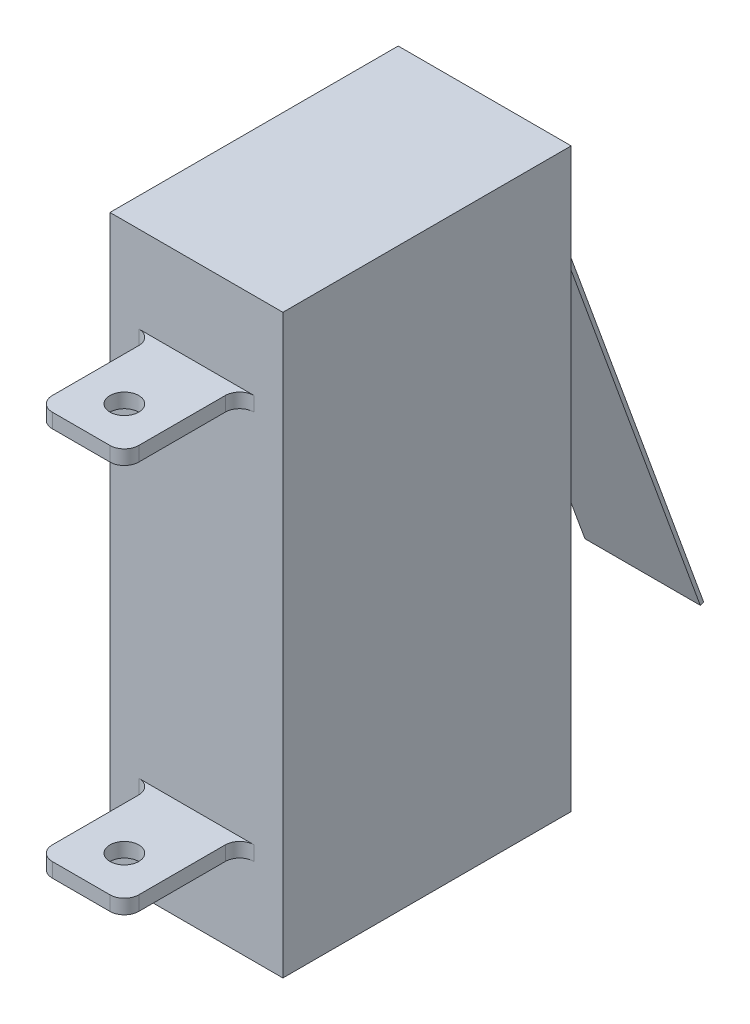
from build123d import *

# Parameters (mm, degrees)
SKETCH1_W               = 10
SKETCH1_H               = 20
BOSS_EXTRUDE1_DEPTH     = 6
SKETCH2_W               = 3
SKETCH2_H               = 0.5
BOSS_EXTRUDE2_DEPTH     = 4
FILLET1_R               = 0.5
CUT_EXTRUDE1_DEPTH      = 21.14944168
CUT_EXTRUDE1_DEPTH_BACK = 21.14944168
SKETCH3_R               = 0.5
BOSS_EXTRUDE3_DEPTH     = 2
FILLET2_R               = 0.5
FILLET3_R               = 0.125


with BuildPart() as part:
    # Sketch1 → Boss-Extrude1 (new body)
    with BuildSketch(Plane(origin=(0, 0, 0), x_dir=(0, 0, -1), z_dir=(1, 0, 0))):
        Rectangle(SKETCH1_W, SKETCH1_H)
    extrude(amount=BOSS_EXTRUDE1_DEPTH)

    # Sketch2 → Boss-Extrude2 (add)
    with BuildSketch(Plane.XY.offset(5)):
        with Locations((3, 6.75)):
            Rectangle(SKETCH2_W, SKETCH2_H)
        with Locations((3, -6.75)):
            Rectangle(SKETCH2_W, SKETCH2_H)
    extrude(amount=BOSS_EXTRUDE2_DEPTH)

    # Fillet1
    fillet1_edges = [part.edges().sort_by_distance(p)[0] for p in [
        (1.5, 6.75, 5),
        (4.5, 6.75, 5),
        (1.5, 6.75, 9),
        (4.5, 6.75, 9),
        (1.5, -6.75, 5),
        (4.5, -6.75, 5),
        (1.5, -6.75, 9),
        (4.5, -6.75, 9),
    ]]
    fillet(fillet1_edges, radius=FILLET1_R)

    # Sketch3 → Cut-Extrude1 (cut, two sides: drawn at the far end of the back side and taken through both)
    with BuildSketch(Plane(origin=(0, 7, 0), x_dir=(1, 0, 0), z_dir=(0, 1, 0)).offset(-CUT_EXTRUDE1_DEPTH_BACK)):
        with Locations(Location((3, -7.5, 0), (0, 0, 270))):
            Circle(SKETCH3_R)
    extrude(amount=CUT_EXTRUDE1_DEPTH + CUT_EXTRUDE1_DEPTH_BACK, mode=Mode.SUBTRACT)

    # Sketch4 → Boss-Extrude3 (add, symmetric)
    with BuildSketch(Plane(origin=(3, 0, 0), x_dir=(0, 0, -1), z_dir=(1, 0, 0))):
        Polygon((5, 7), (5.5, 7), (10.59558328, -7), (10.478121702, -7.042752518), (5.412474058, 6.875), (5, 6.875), (4.5, 6.875), (4.5, 7), align=None)
    extrude(amount=BOSS_EXTRUDE3_DEPTH, both=True)

    # Fillet2
    fillet2_edges = [part.edges().sort_by_distance(p)[0] for p in [
        (3, 7, -5.5),
        (3, 6.875, -5.412474058),
    ]]
    fillet(fillet2_edges, radius=FILLET2_R)

    # Fillet3
    # the kernel refuses this fillet: 0.125 mm, written as the material it adds along each edge
    with BuildSketch(Plane(origin=(1, 6.875, -5), x_dir=(-1, 0, 0), z_dir=(0, 1, 0)), Plane(origin=(5, 6.875, -5), x_dir=(0, 0, -1), z_dir=(0, 1, 0))) as fillet3_piece_1:
        with BuildLine():
            CenterArc((FILLET3_R, -FILLET3_R), FILLET3_R, 90, 90)
            Line((0, -FILLET3_R), (-FILLET3_R * 0.02, -FILLET3_R))
            Line((-FILLET3_R * 0.02, -FILLET3_R), (-FILLET3_R * 0.02, FILLET3_R * 0.02))
            Line((-FILLET3_R * 0.02, FILLET3_R * 0.02), (FILLET3_R, FILLET3_R * 0.02))
            Line((FILLET3_R, FILLET3_R * 0.02), (FILLET3_R, 0))
        make_face()
    extrude(amount=0.125)
    with BuildSketch(Plane(origin=(1, 6.875, -5), x_dir=(0, -1, 0), z_dir=(1, 0, 0))) as fillet3_piece_2:
        with BuildLine():
            CenterArc((0.130266962, 0.125), FILLET3_R, 170.385831611, 99.614168389)
            Line((0.007022616, 0.14587657), (-0.005301818, 0.147964228))
            ThreePointArc((-0.005301818, 0.147964228), (-0.0125, 0.062370289), (-0.0125, 0))
            Line((-0.0125, 0), (0, -0.0125))
            Line((0, -0.0125), (0.130266962, -0.0125))
            Line((0.130266962, -0.0125), (0.130266962, 0))
        make_face()
    extrude(amount=4)
    with BuildSketch(Plane(origin=(5, 7, -5), x_dir=(0, 0, -1), z_dir=(-1, 0, 0))) as fillet3_piece_3:
        with BuildLine():
            CenterArc((FILLET3_R, -FILLET3_R), FILLET3_R, 90, 90)
            Line((0, -FILLET3_R), (-FILLET3_R * 0.02, -FILLET3_R))
            Line((-FILLET3_R * 0.02, -FILLET3_R), (-FILLET3_R * 0.02, FILLET3_R * 0.02))
            Line((-FILLET3_R * 0.02, FILLET3_R * 0.02), (FILLET3_R, FILLET3_R * 0.02))
            Line((FILLET3_R, FILLET3_R * 0.02), (FILLET3_R, 0))
        make_face()
    extrude(amount=4)
    with BuildSketch(Plane(origin=(0.634886225, 6.875, -5), x_dir=(0, -1, 0), z_dir=(1, 0, 0))) as fillet3_piece_4a_section:
        with BuildLine():
            CenterArc((0.130266962, 0.125), FILLET3_R, 170.385831611, 99.614168389)
            Line((0.007022616, 0.14587657), (-0.005301818, 0.147964228))
            ThreePointArc((-0.005301818, 0.147964228), (-0.0125, 0.062370289), (-0.0125, 0))
            Line((-0.0125, 0), (0, -0.0125))
            Line((0, -0.0125), (0.130266962, -0.0125))
            Line((0.130266962, -0.0125), (0.130266962, 0))
        make_face()
    fillet3_piece_4a = extrude(amount=4.365113775, mode=Mode.PRIVATE)
    fillet3_piece_4a = split(fillet3_piece_4a, bisect_by=Plane(origin=(1, 6.846895643, -5.033240906), z_dir=(-1, 0, 0)), keep=Keep.TOP, mode=Mode.PRIVATE)
    with BuildSketch(Plane(origin=(1, 6.5625, -5), x_dir=(-1, 0, 0), z_dir=(0, 1, 0))) as fillet3_piece_4b_section:
        with BuildLine():
            CenterArc((FILLET3_R, -FILLET3_R), FILLET3_R, 90, 90)
            Line((0, -FILLET3_R), (-FILLET3_R * 0.02, -FILLET3_R))
            Line((-FILLET3_R * 0.02, -FILLET3_R), (-FILLET3_R * 0.02, FILLET3_R * 0.02))
            Line((-FILLET3_R * 0.02, FILLET3_R * 0.02), (FILLET3_R, FILLET3_R * 0.02))
            Line((FILLET3_R, FILLET3_R * 0.02), (FILLET3_R, 0))
        make_face()
    fillet3_piece_4b = extrude(amount=0.4375, mode=Mode.PRIVATE)
    fillet3_piece_4b = split(fillet3_piece_4b, bisect_by=Plane(origin=(0.971700611, 6.875, -5.028299389), z_dir=(0, -1, 0)), keep=Keep.TOP, mode=Mode.PRIVATE)
    fillet3_piece_4 = fillet3_piece_4a & fillet3_piece_4b
    add(fillet3_piece_4)
    with BuildSketch(Plane(origin=(5, 7, -5), x_dir=(0, 0, -1), z_dir=(-1, 0, 0))) as fillet3_piece_5a_section:
        with BuildLine():
            CenterArc((FILLET3_R, -FILLET3_R), FILLET3_R, 90, 90)
            Line((0, -FILLET3_R), (-FILLET3_R * 0.02, -FILLET3_R))
            Line((-FILLET3_R * 0.02, -FILLET3_R), (-FILLET3_R * 0.02, FILLET3_R * 0.02))
            Line((-FILLET3_R * 0.02, FILLET3_R * 0.02), (FILLET3_R, FILLET3_R * 0.02))
            Line((FILLET3_R, FILLET3_R * 0.02), (FILLET3_R, 0))
        make_face()
    fillet3_piece_5a = extrude(amount=4.3125, mode=Mode.PRIVATE)
    fillet3_piece_5a = split(fillet3_piece_5a, bisect_by=Plane(origin=(1, 7.028299389, -5.028299389), z_dir=(-1, 0, 0)), keep=Keep.TOP, mode=Mode.PRIVATE)
    with BuildSketch(Plane(origin=(1, 6.875, -5), x_dir=(-1, 0, 0), z_dir=(0, 1, 0))) as fillet3_piece_5b_section:
        with BuildLine():
            CenterArc((FILLET3_R, -FILLET3_R), FILLET3_R, 90, 90)
            Line((0, -FILLET3_R), (-FILLET3_R * 0.02, -FILLET3_R))
            Line((-FILLET3_R * 0.02, -FILLET3_R), (-FILLET3_R * 0.02, FILLET3_R * 0.02))
            Line((-FILLET3_R * 0.02, FILLET3_R * 0.02), (FILLET3_R, FILLET3_R * 0.02))
            Line((FILLET3_R, FILLET3_R * 0.02), (FILLET3_R, 0))
        make_face()
    fillet3_piece_5b = extrude(amount=0.4375, mode=Mode.PRIVATE)
    fillet3_piece_5b = split(fillet3_piece_5b, bisect_by=Plane(origin=(0.971700611, 7, -5.028299389), z_dir=(0, 1, 0)), keep=Keep.TOP, mode=Mode.PRIVATE)
    fillet3_piece_5 = fillet3_piece_5a & fillet3_piece_5b
    add(fillet3_piece_5)
    with BuildSketch(Plane(origin=(5, 6.5625, -5), x_dir=(0, 0, -1), z_dir=(0, 1, 0))) as fillet3_piece_6a_section:
        with BuildLine():
            CenterArc((FILLET3_R, -FILLET3_R), FILLET3_R, 90, 90)
            Line((0, -FILLET3_R), (-FILLET3_R * 0.02, -FILLET3_R))
            Line((-FILLET3_R * 0.02, -FILLET3_R), (-FILLET3_R * 0.02, FILLET3_R * 0.02))
            Line((-FILLET3_R * 0.02, FILLET3_R * 0.02), (FILLET3_R, FILLET3_R * 0.02))
            Line((FILLET3_R, FILLET3_R * 0.02), (FILLET3_R, 0))
        make_face()
    fillet3_piece_6a = extrude(amount=0.4375, mode=Mode.PRIVATE)
    fillet3_piece_6a = split(fillet3_piece_6a, bisect_by=Plane(origin=(5.028299389, 6.875, -5.028299389), z_dir=(0, -1, 0)), keep=Keep.TOP, mode=Mode.PRIVATE)
    with BuildSketch(Plane(origin=(1, 6.875, -5), x_dir=(0, -1, 0), z_dir=(1, 0, 0))) as fillet3_piece_6b_section:
        with BuildLine():
            CenterArc((0.130266962, 0.125), FILLET3_R, 170.385831611, 99.614168389)
            Line((0.007022616, 0.14587657), (-0.005301818, 0.147964228))
            ThreePointArc((-0.005301818, 0.147964228), (-0.0125, 0.062370289), (-0.0125, 0))
            Line((-0.0125, 0), (0, -0.0125))
            Line((0, -0.0125), (0.130266962, -0.0125))
            Line((0.130266962, -0.0125), (0.130266962, 0))
        make_face()
    fillet3_piece_6b = extrude(amount=4.365113775, mode=Mode.PRIVATE)
    fillet3_piece_6b = split(fillet3_piece_6b, bisect_by=Plane(origin=(5, 6.846895643, -5.033240906), z_dir=(1, 0, 0)), keep=Keep.TOP, mode=Mode.PRIVATE)
    fillet3_piece_6 = fillet3_piece_6a & fillet3_piece_6b
    add(fillet3_piece_6)
    with BuildSketch(Plane(origin=(5, 6.875, -5), x_dir=(0, 0, -1), z_dir=(0, 1, 0))) as fillet3_piece_7a_section:
        with BuildLine():
            CenterArc((FILLET3_R, -FILLET3_R), FILLET3_R, 90, 90)
            Line((0, -FILLET3_R), (-FILLET3_R * 0.02, -FILLET3_R))
            Line((-FILLET3_R * 0.02, -FILLET3_R), (-FILLET3_R * 0.02, FILLET3_R * 0.02))
            Line((-FILLET3_R * 0.02, FILLET3_R * 0.02), (FILLET3_R, FILLET3_R * 0.02))
            Line((FILLET3_R, FILLET3_R * 0.02), (FILLET3_R, 0))
        make_face()
    fillet3_piece_7a = extrude(amount=0.4375, mode=Mode.PRIVATE)
    fillet3_piece_7a = split(fillet3_piece_7a, bisect_by=Plane(origin=(5.028299389, 7, -5.028299389), z_dir=(0, 1, 0)), keep=Keep.TOP, mode=Mode.PRIVATE)
    with BuildSketch(Plane(origin=(5.3125, 7, -5), x_dir=(0, 0, -1), z_dir=(-1, 0, 0))) as fillet3_piece_7b_section:
        with BuildLine():
            CenterArc((FILLET3_R, -FILLET3_R), FILLET3_R, 90, 90)
            Line((0, -FILLET3_R), (-FILLET3_R * 0.02, -FILLET3_R))
            Line((-FILLET3_R * 0.02, -FILLET3_R), (-FILLET3_R * 0.02, FILLET3_R * 0.02))
            Line((-FILLET3_R * 0.02, FILLET3_R * 0.02), (FILLET3_R, FILLET3_R * 0.02))
            Line((FILLET3_R, FILLET3_R * 0.02), (FILLET3_R, 0))
        make_face()
    fillet3_piece_7b = extrude(amount=4.3125, mode=Mode.PRIVATE)
    fillet3_piece_7b = split(fillet3_piece_7b, bisect_by=Plane(origin=(5, 7.028299389, -5.028299389), z_dir=(1, 0, 0)), keep=Keep.TOP, mode=Mode.PRIVATE)
    fillet3_piece_7 = fillet3_piece_7a & fillet3_piece_7b
    add(fillet3_piece_7)


solid = part.part
